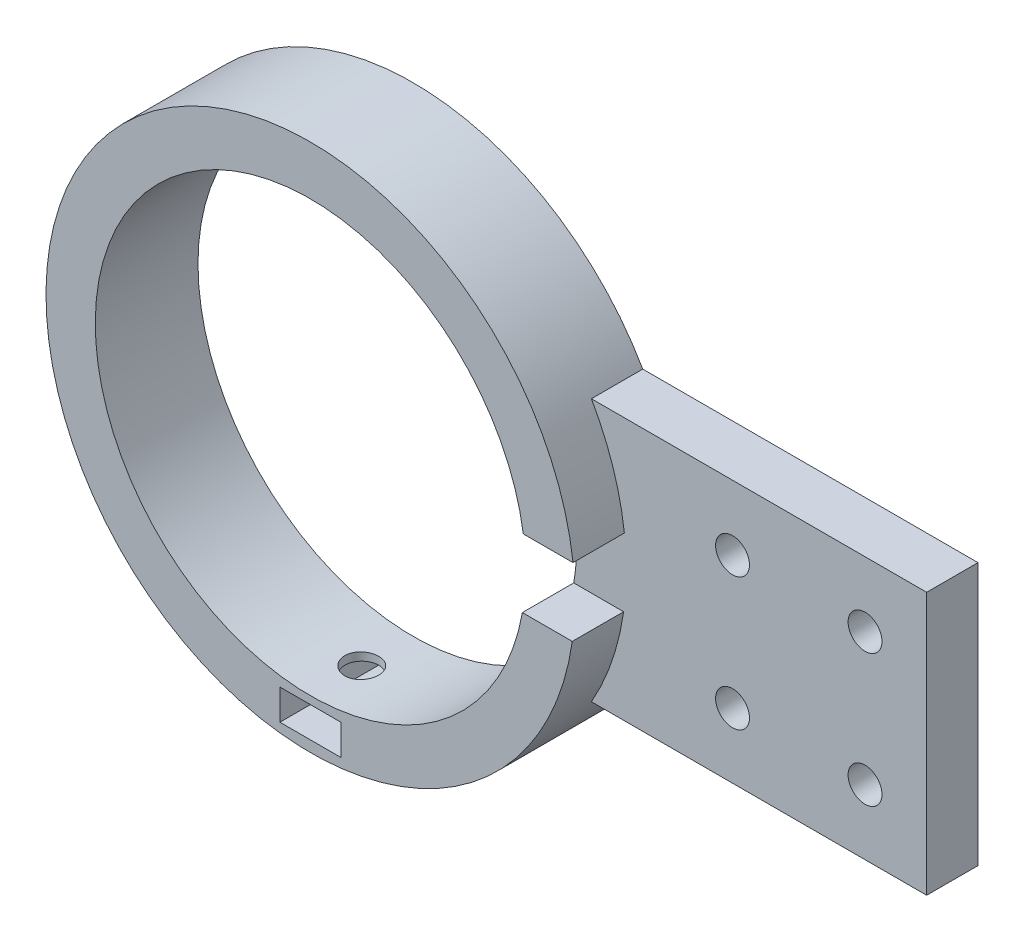
from build123d import *

# Parameters (mm, degrees)
SKETCH1_R              = 51.5
BOSS_EXTRUDE1_DEPTH    = 20
BOSS_EXTRUDE2_DEPTH    = 10
SKETCH2_R              = 41.9
CUT_EXTRUDE1_DEPTH     = 124.094475912
SKETCH3_W              = 35
SKETCH3_H              = 13.351317372
CUT_EXTRUDE2_DEPTH     = 10
SKETCH4_W              = 11.9
SKETCH4_H              = 5.94
CUT_EXTRUDE3_DEPTH     = 124.094475912
CUT_EXTRUDE4_START     = -51.500000101
CUT_EXTRUDE4_OUTLINE_R = 3.3
CUT_EXTRUDE4_DEPTH     = 9.730154575
SKETCH5_R              = 3.3
CUT_EXTRUDE5_DEPTH     = 122.869807632


# Read off the part's stored shape, not the designer's step: Cut-Extrude4
with BuildPart() as part:
    # Sketch1 → Boss-Extrude1 (new body)
    with BuildSketch(Plane.XY):
        Circle(SKETCH1_R)
    extrude(amount=BOSS_EXTRUDE1_DEPTH)

    # 3DSketch1 → Boss-Extrude2 (add)
    with BuildSketch(Plane(origin=(0, -25.55, 0), x_dir=(0.9069189732091603, 0.4213050866453462, 0), z_dir=(0, 0, -1))):
        Polygon((0, 0), (99.761087053, 46.343559531), (121.289776981, 0), (21.528689928, -46.343559531), align=None)
    extrude(amount=-BOSS_EXTRUDE2_DEPTH)

    # Sketch2 → Cut-Extrude1 (cut, through all)
    with BuildSketch(Plane.XY.offset(20)):
        Circle(SKETCH2_R)
    extrude(amount=-CUT_EXTRUDE1_DEPTH, mode=Mode.SUBTRACT)

    # Sketch3 → Cut-Extrude2 (cut)
    with BuildSketch(Plane.XY.offset(20)):
        with Locations((56.5, -0.55960538)):
            Rectangle(SKETCH3_W, SKETCH3_H)
    extrude(amount=-CUT_EXTRUDE2_DEPTH, mode=Mode.SUBTRACT)

    # Sketch4 → Cut-Extrude3 (cut, through all)
    with BuildSketch(Plane.XY.offset(20)):
        with Locations((0, -46.37)):
            Rectangle(SKETCH4_W, SKETCH4_H)
    extrude(amount=-CUT_EXTRUDE3_DEPTH, mode=Mode.SUBTRACT)

    # Cut-Extrude4 outline → Cut-Extrude4 (cut)
    with BuildSketch(Plane(origin=(0, 0, 0), x_dir=(1, 0, 0), z_dir=(0, 1, 0)).offset(CUT_EXTRUDE4_START)):
        with Locations((0, -10)):
            Circle(CUT_EXTRUDE4_OUTLINE_R)
    extrude(amount=CUT_EXTRUDE4_DEPTH, mode=Mode.SUBTRACT)

    # Sketch5 → Cut-Extrude5 (cut, through all)
    with BuildSketch(Plane.XY.offset(10)):
        with Locations((72.2, 12.9)):
            Circle(SKETCH5_R)
        with Locations((98, 12.9)):
            Circle(SKETCH5_R)
        with Locations((98, -12.9)):
            Circle(SKETCH5_R)
        with Locations((72.2, -12.9)):
            Circle(SKETCH5_R)
    extrude(amount=-CUT_EXTRUDE5_DEPTH, mode=Mode.SUBTRACT)


solid = part.part
